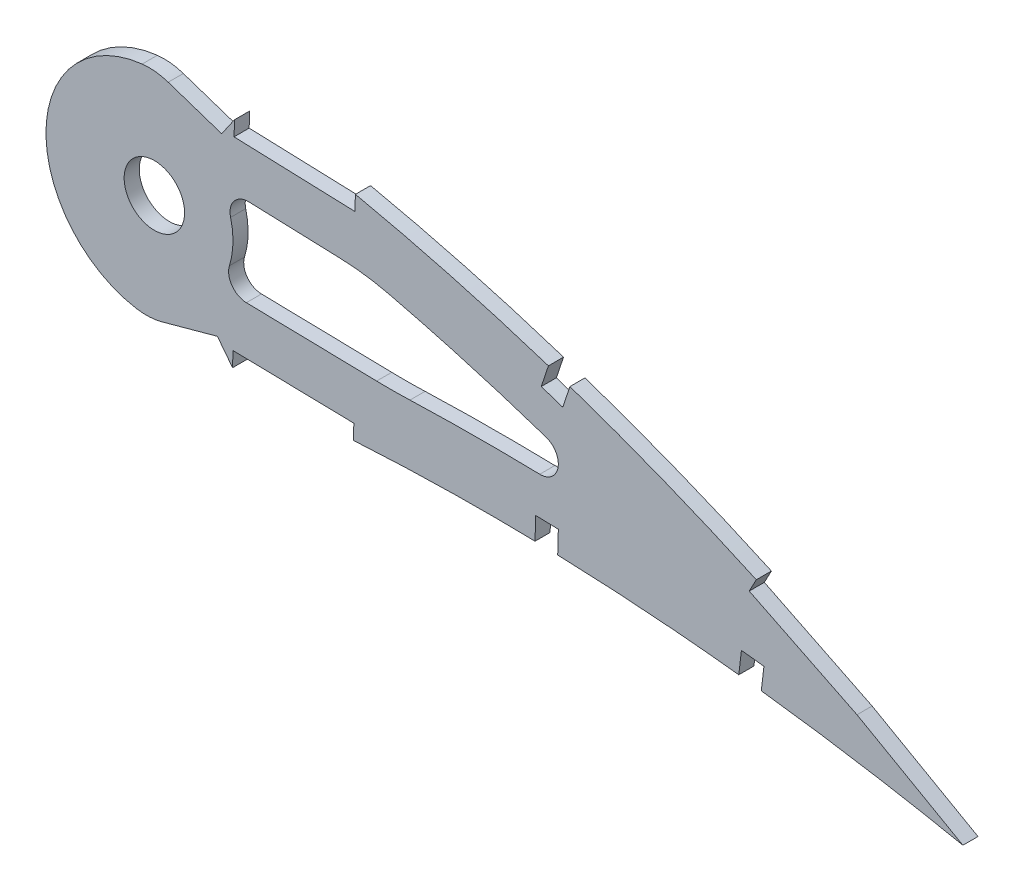
from build123d import *

# Parameters (mm, degrees)
BOSS_EXTRUDE1_DEPTH = 3.175
SKETCH2_R           = 6.35
CUT_EXTRUDE2_DEPTH  = 564.352625878
CUT_EXTRUDE3_DEPTH  = 563.080828658
FILLET1_R           = 50.8
FILLET1_R_2         = 127
FILLET1_R_3         = 12.7
FILLET2_R           = 3.81


with BuildPart() as part:
    # Sketch1 → Boss-Extrude1 (new body)
    with BuildSketch(Plane.XY):
        with BuildLine():
            Line((554.319679776, 0.86419944), (558.957809165, -2.001035064))
            Line((558.957809165, -2.001035064), (553.628320224, -0.86419944))
            add(Edge.make_bspline(
                [(0, 0), (0.142347333, -0.671974339), (0.427696201, -2.019011291), (1.202951825, -3.958186399), (2.228190383, -5.822295383), (3.524929277, -7.606386734), (5.084546434, -9.309972854), (6.903597265, -10.934825666), (8.980297835, -12.480071531), (11.311930113, -13.945007192), (13.895107055, -15.331187734), (16.726925172, -16.637751335), (19.804802415, -17.864289685), (23.125385358, -19.009163213), (26.684614497, -20.074115536), (30.479105895, -21.056551439), (34.504544841, -21.957844058), (38.757059621, -22.775692741), (43.232016315, -23.51092839), (47.924766072, -24.163139529), (52.830492114, -24.732734078), (57.944381557, -25.218516849), (63.261376247, -25.621532707), (68.776176668, -25.942049027), (74.483429701, -26.181082136), (80.377668399, -26.337723359), (86.453120028, -26.414414727), (92.704294081, -26.412307583), (99.12507542, -26.330838336), (105.709979181, -26.174507632), (112.452686417, -25.942325241), (119.34710982, -25.637100851), (126.387030529, -25.261906112), (133.566134503, -24.818012975), (140.878103886, -24.307388732), (148.316589874, -23.734128332), (155.874835295, -23.099661672), (163.546248351, -22.407686904), (171.324037493, -21.661668186), (179.201482843, -20.863966544), (187.171631155, -20.018334408), (195.227383554, -19.127512044), (203.361887075, -18.196251983), (211.567710876, -17.226239107), (219.837916048, -16.22301178), (228.164722411, -15.188486752), (236.541167073, -14.126648704), (244.959716224, -13.042497308), (253.412488668, -11.935908902), (261.892375024, -10.814767477), (270.391197565, -9.678149682), (278.901558654, -8.531901132), (287.415580323, -7.379584718), (295.924969849, -6.221555103), (304.422247183, -5.062611436), (312.899529628, -3.905935256), (321.348513524, -2.751632242), (329.761554776, -1.605439772), (338.130181703, -0.467217682), (346.446677596, 0.66072628), (354.703072912, 1.775025333), (362.891578136, 2.874273125), (371.003746299, 3.95777416), (379.031415912, 5.025935363), (386.846329345, 6.046335331), (394.428066205, 7.073310729), (401.802175451, 7.915202937), (409.084467689, 8.633788237), (416.282507375, 9.222929029), (423.387651297, 9.691101248), (430.391758492, 10.041650224), (437.286481508, 10.279470026), (444.063111322, 10.411615906), (450.713183761, 10.441441391), (457.227621753, 10.378458054), (463.597952606, 10.227742854), (469.815285453, 9.996060674), (475.870946567, 9.691228076), (481.756334452, 9.321555013), (487.462613384, 8.892494437), (492.981831848, 8.414063018), (498.305474549, 7.893264408), (503.42536692, 7.336048865), (508.334038343, 6.754092224), (513.023631908, 6.151226115), (517.487093749, 5.537357776), (521.717238913, 4.918708145), (525.707368004, 4.303175514), (529.451211936, 3.69663199), (532.942723228, 3.107128036), (536.176432542, 2.540171416), (539.146728498, 2.001298937), (541.849490456, 1.497309641), (544.279380439, 1.030707122), (546.433148645, 0.609181062), (548.306790372, 0.234591467), (549.897558991, -0.087784135), (551.202676422, -0.356673457), (552.220160436, -0.56766247), (552.948001318, -0.721088328), (553.38541182, -0.812384542), (553.579758931, -0.853840809), (553.628320224, -0.86419944)],
                knots=[0, 0, 0, 0, 0.003638255, 0.007293231, 0.011028136, 0.014901081, 0.018963272, 0.023258475, 0.027820626, 0.032679082, 0.03785316, 0.043361875, 0.049214679, 0.055422346, 0.061988786, 0.068918036, 0.076211157, 0.083868392, 0.091887411, 0.100265912, 0.108999867, 0.118084529, 0.127514843, 0.13728527, 0.147387917, 0.157816481, 0.168563473, 0.179619128, 0.190977373, 0.202626974, 0.214560478, 0.226767249, 0.239236417, 0.251959004, 0.264923894, 0.278119703, 0.291536035, 0.30516028, 0.318980685, 0.332985499, 0.34716279, 0.361498603, 0.375980747, 0.390597192, 0.405332593, 0.420174823, 0.435109533, 0.450124276, 0.465203068, 0.480333154, 0.495500583, 0.510689775, 0.525887334, 0.541078314, 0.556247233, 0.571381784, 0.58646604, 0.601484516, 0.616424329, 0.631269422, 0.646006524, 0.660620684, 0.675098187, 0.689422858, 0.703581825, 0.716907563, 0.730009274, 0.742952128, 0.755725558, 0.768319952, 0.780724337, 0.792926529, 0.804916041, 0.816679084, 0.828203524, 0.8394749, 0.850481359, 0.861207697, 0.871639326, 0.881763414, 0.891563605, 0.901027364, 0.910138977, 0.918883976, 0.927249278, 0.935221104, 0.942784739, 0.949928188, 0.956638464, 0.962904203, 0.968712288, 0.974054485, 0.978918432, 0.983297218, 0.987180246, 0.990560674, 0.993433357, 0.995790626, 0.997629587, 0.998945816, 0.999736592, 1, 1, 1, 1], degree=3))
            add(Edge.make_bspline(
                [(554.319679776, 0.86419944), (554.277215357, 0.89043211), (554.107522459, 0.995260998), (553.725173452, 1.229788681), (553.088482836, 1.620406322), (552.19717161, 2.164400829), (551.051931791, 2.860327436), (549.65218736, 3.7033132), (547.998812126, 4.690619378), (546.092206237, 5.81757636), (543.932565, 7.078907467), (541.52071076, 8.469502775), (538.856853433, 9.981489509), (535.942024994, 11.608689713), (532.777225355, 13.343364367), (529.363053286, 15.177678879), (525.700731311, 17.102302694), (521.79166531, 19.108957931), (517.636567952, 21.18656326), (513.237398289, 23.326472309), (508.595621965, 25.518015349), (503.712823317, 27.749500198), (498.591807417, 30.011830061), (493.233990123, 32.290940283), (487.642424763, 34.57695634), (481.8194918, 36.856868062), (475.768638934, 39.12029206), (469.492200651, 41.35256543), (462.994868721, 43.543932934), (456.279795024, 45.680158729), (449.351781723, 47.749641178), (442.214854104, 49.738962731), (434.874961581, 51.637921), (427.336759134, 53.432686996), (419.606635925, 55.111247293), (411.690736529, 56.663495899), (403.59569977, 58.073935714), (395.343957759, 59.341467114), (387.068279135, 60.395838633), (378.809627081, 61.42993544), (370.563274167, 62.401374837), (362.216133558, 63.331662392), (353.776235693, 64.21556045), (345.251952273, 65.05030505), (336.651912889, 65.832293537), (327.985054567, 66.559232675), (319.259763743, 67.227003304), (310.485240764, 67.834576684), (301.670160415, 68.37661144), (292.823911811, 68.852700647), (283.955475072, 69.25952388), (275.074079257, 69.594278035), (266.18915515, 69.854942273), (257.309925599, 70.039019354), (248.446004557, 70.145351939), (239.606611877, 70.171034575), (230.801357025, 70.115607817), (222.039460543, 69.97716855), (213.3305417, 69.753821594), (204.683833617, 69.445150093), (196.108686361, 69.051287938), (187.614488849, 68.568936811), (179.210455771, 68.001170586), (170.905945703, 67.345604232), (162.710082946, 66.602063396), (154.631456842, 65.773647434), (146.679061666, 64.85810318), (138.86141998, 63.858035618), (131.187082706, 62.775405546), (123.664660665, 61.60962319), (116.302212041, 60.364055914), (109.107683022, 59.039978082), (102.088685401, 57.641271481), (95.252861003, 56.16830103), (88.607445909, 54.6254852), (82.159346438, 53.015511993), (75.915494147, 51.341328746), (69.8822185, 49.606952764), (64.065620452, 47.816318831), (58.472480769, 45.971394518), (53.107026632, 44.079174913), (47.975848961, 42.141003285), (43.082878389, 40.162850581), (38.433849103, 38.1474178), (34.032234114, 36.100849009), (29.88301504, 34.025474172), (25.989149052, 31.927107779), (22.354545271, 29.808967438), (18.982702419, 27.674987384), (15.875037644, 25.530580581), (13.035835571, 23.377093004), (10.466071509, 21.219966433), (8.16737168, 19.062485607), (6.143021854, 16.906136722), (4.392949166, 14.754717117), (2.919447156, 12.609930647), (1.722771461, 10.473806788), (0.805628768, 8.347897258), (0.167109617, 6.233397613), (-0.182411483, 4.133428796), (-0.269409401, 2.046307302), (-0.089668952, 0.681083253), (0, 0)],
                knots=[0, 0, 0, 0, 0.00025409, 0.001015373, 0.002283359, 0.004056577, 0.006330982, 0.009105274, 0.012374489, 0.016134023, 0.02037966, 0.025105976, 0.030306237, 0.035972206, 0.042099522, 0.048678064, 0.055701664, 0.063160184, 0.071045824, 0.079349827, 0.08806291, 0.097175756, 0.106678112, 0.116561573, 0.126814276, 0.137428301, 0.148393618, 0.15969976, 0.171338126, 0.183297699, 0.195569604, 0.208143555, 0.221011593, 0.234161831, 0.24758745, 0.261276822, 0.27522271, 0.289414144, 0.3037712, 0.317689227, 0.331784111, 0.346039677, 0.360443869, 0.37498272, 0.389640454, 0.404403317, 0.419256601, 0.434186749, 0.449177265, 0.464214782, 0.479284009, 0.49436974, 0.509457833, 0.524532346, 0.53957932, 0.554582984, 0.569529546, 0.584403417, 0.599190992, 0.613876838, 0.628447475, 0.642888675, 0.657186054, 0.671325546, 0.685294014, 0.699078147, 0.712665095, 0.726042645, 0.739197713, 0.752117586, 0.764792042, 0.777208152, 0.789355685, 0.80122396, 0.812803686, 0.824082909, 0.835054602, 0.845709571, 0.856037853, 0.866033834, 0.875688843, 0.884997719, 0.893953426, 0.902552897, 0.910789386, 0.918660734, 0.926166253, 0.933302626, 0.94007122, 0.94647478, 0.952517526, 0.958204819, 0.963546652, 0.9685566, 0.973249913, 0.977651041, 0.981787043, 0.985694226, 0.989415109, 0.993001157, 0.996508416, 1, 1, 1, 1], degree=3))
        make_face()
    extrude(amount=BOSS_EXTRUDE1_DEPTH)

    # Sketch2 → Cut-Extrude2 (cut, through all)
    with BuildSketch(Plane.XY.offset(3.175)):
        with BuildLine():
            add(Edge.make_bspline(
                [(430.319647944, 22.731694653), (431.264230074, 22.770688174), (435.808989207, 22.944352135), (447.913572783, 23.229268702), (465.339210521, 23.013958543), (479.127970057, 22.247870873), (485.365038234, 21.782948535)],
                knots=[0.781455055, 0.781455055, 0.781455055, 0.781455055, 0.786332099, 0.804918237, 0.84393459, 0.876262436, 0.876262436, 0.876262436, 0.876262436], degree=3))
            add(Edge.make_bspline(
                [(485.365038234, 21.782948535), (479.761968163, 24.067699535), (467.25658071, 28.842360136), (447.690245821, 35.194739683), (432.770350963, 39.127735095), (424.880445033, 40.94125454), (423.987569299, 41.143106247)],
                knots=[0.122316233, 0.122316233, 0.122316233, 0.122316233, 0.15408987, 0.192612338, 0.230383121, 0.235198429, 0.235198429, 0.235198429, 0.235198429], degree=3))
            Line((423.987569299, 41.143106247), (393.784366968, 42.194221297))
            ThreePointArc((393.784366968, 42.194221297), (395.753496119, 37.904332136), (396.428257434, 33.232574886))
            ThreePointArc((396.428257434, 33.232574886), (395.61695356, 28.120721999), (393.262777127, 23.511263546))
            Line((393.262777127, 23.511263546), (430.319647944, 22.731694653))
        make_face()
        with BuildLine():
            Line((396.762798542, 55.433640414), (396.889843899, 59.084217589))
            add(Edge.make_bspline(
                [(396.889843899, 59.084217589), (396.383806872, 59.157719538), (393.085664831, 59.629187295), (388.86659439, 60.166722391), (385.154250522, 60.634214657), (384.240082989, 60.748731992)],
                knots=[0.286811105, 0.286811105, 0.286811105, 0.286811105, 0.289414144, 0.3037712, 0.3084612, 0.3084612, 0.3084612, 0.3084612], degree=3))
            add(Edge.make_bspline(
                [(384.240082989, 60.748731992), (383.657484653, 60.821713811), (383.074858449, 60.894454232), (382.492195116, 60.966884375)],
                knots=[0.3084612, 0.3084612, 0.3084612, 0.3084612, 0.311450134, 0.311450134, 0.311450134, 0.311450134], degree=3))
            ThreePointArc((382.492195116, 60.966884375), (369.217960933, 58.948731924), (358.430176965, 50.95486243))
            add(Edge.make_bspline(
                [(364.799446961, 50.263533696), (363.364931465, 50.422919238), (361.241622812, 50.655054407), (359.11839834, 50.881893785), (358.430176965, 50.95486243)],
                knots=[0.339284908, 0.339284908, 0.339284908, 0.339284908, 0.346702208, 0.350259533, 0.350259533, 0.350259533, 0.350259533], degree=3))
            ThreePointArc((364.799446961, 50.263533696), (372.203432265, 54.659507954), (380.710328366, 55.992289553))
            Line((380.710328366, 55.992289553), (396.762798542, 55.433640414))
        make_face()
        with BuildLine():
            ThreePointArc((365.057349478, 15.976115144), (357.145408535, 33.061282461), (364.799446961, 50.263533696))
            add(Edge.make_bspline(
                [(364.799446961, 50.263533696), (363.364931465, 50.422919238), (361.241622812, 50.655054407), (359.11839834, 50.881893785), (358.430176965, 50.95486243)],
                knots=[0.339284908, 0.339284908, 0.339284908, 0.339284908, 0.346702208, 0.350259533, 0.350259533, 0.350259533, 0.350259533], degree=3))
            ThreePointArc((358.430176965, 50.95486243), (352.065861583, 32.985343449), (358.748161408, 15.131632582))
            add(Edge.make_bspline(
                [(358.748161408, 15.131632582), (360.851423884, 15.413689954), (362.954628563, 15.695174464), (365.057349478, 15.976115144)],
                knots=[0.65619395, 0.65619395, 0.65619395, 0.65619395, 0.667439043, 0.667439043, 0.667439043, 0.667439043], degree=3))
        make_face()
        with BuildLine():
            ThreePointArc((379.439275285, 10.464119422), (371.768191096, 11.96738251), (365.057349478, 15.976115144))
            add(Edge.make_bspline(
                [(358.748161408, 15.131632582), (360.851423884, 15.413689954), (362.954628563, 15.695174464), (365.057349478, 15.976115144)],
                knots=[0.65619395, 0.65619395, 0.65619395, 0.65619395, 0.667439043, 0.667439043, 0.667439043, 0.667439043], degree=3))
            ThreePointArc((358.748161408, 15.131632582), (369.94298629, 7.226593966), (383.552675487, 5.61721533))
            add(Edge.make_bspline(
                [(383.552675487, 5.61721533), (384.702288335, 5.768514236), (388.342225507, 6.248960215), (392.585302947, 6.823701363), (395.684467852, 7.202111347), (396.290352256, 7.274612839)],
                knots=[0.697430662, 0.697430662, 0.697430662, 0.697430662, 0.703581825, 0.716907563, 0.720144627, 0.720144627, 0.720144627, 0.720144627], degree=3))
            Line((396.290352256, 7.274612839), (396.349966223, 10.108367619))
            Line((396.349966223, 10.108367619), (379.439275285, 10.464119422))
        make_face()
        with BuildLine():
            ThreePointArc((358.430176965, 50.95486243), (369.217960933, 58.948731924), (382.492195116, 60.966884375))
            add(Edge.make_bspline(
                [(382.492195116, 60.966884375), (381.275945111, 61.118074877), (377.311508316, 61.606417287), (370.563274167, 62.401374837), (362.216133558, 63.331662392), (353.776235693, 64.21556045), (345.251952273, 65.05030505), (336.651912889, 65.832293537), (327.985054567, 66.559232675), (319.259763743, 67.227003304), (310.485240764, 67.834576684), (301.670160415, 68.37661144), (292.823911811, 68.852700647), (283.955475072, 69.25952388), (275.074079257, 69.594278035), (266.18915515, 69.854942273), (257.309925599, 70.039019354), (248.446004557, 70.145351939), (239.606611877, 70.171034575), (230.801357025, 70.115607817), (222.039460543, 69.97716855), (213.3305417, 69.753821594), (207.056942761, 69.529865705), (203.687254317, 69.389343527), (203.200000001, 69.368596042)],
                knots=[0.311450134, 0.311450134, 0.311450134, 0.311450134, 0.317689227, 0.331784111, 0.346039677, 0.360443869, 0.37498272, 0.389640454, 0.404403317, 0.419256601, 0.434186749, 0.449177265, 0.464214782, 0.479284009, 0.49436974, 0.509457833, 0.524532346, 0.53957932, 0.554582984, 0.569529546, 0.584403417, 0.599190992, 0.613876838, 0.616359481, 0.616359481, 0.616359481, 0.616359481], degree=3))
            add(Edge.make_bspline(
                [(203.200000001, 69.368596042), (200.827557407, 69.267576479), (195.621767882, 69.023637807), (187.614488849, 68.568936811), (179.210455771, 68.001170586), (170.905945703, 67.345604232), (162.710082946, 66.602063396), (154.631456842, 65.773647434), (146.679061666, 64.85810318), (138.86141998, 63.858035618), (131.187082706, 62.775405546), (123.664660665, 61.60962319), (116.302212041, 60.364055914), (109.107683022, 59.039978082), (102.088685401, 57.641271481), (95.252861003, 56.16830103), (88.607445909, 54.6254852), (82.159346438, 53.015511993), (75.915494147, 51.341328746), (69.8822185, 49.606952764), (64.065620452, 47.816318831), (58.472480769, 45.971394518), (53.107026632, 44.079174913), (47.975848961, 42.141003285), (43.082878389, 40.162850581), (38.433849103, 38.1474178), (34.032234114, 36.100849009), (29.88301504, 34.025474172), (25.989149052, 31.927107779), (22.354545271, 29.808967438), (18.982702419, 27.674987384), (15.875037644, 25.530580581), (13.035835571, 23.377093004), (10.466071509, 21.219966433), (8.16737168, 19.062485607), (6.143021854, 16.906136722), (4.392949166, 14.754717117), (2.919447156, 12.609930647), (1.722771461, 10.473806788), (0.805628768, 8.347897258), (0.167109617, 6.233397613), (-0.182411483, 4.133428796), (-0.269409401, 2.046307302), (-0.089668952, 0.681083253), (0, 0)],
                knots=[0.616359481, 0.616359481, 0.616359481, 0.616359481, 0.628447475, 0.642888675, 0.657186054, 0.671325546, 0.685294014, 0.699078147, 0.712665095, 0.726042645, 0.739197713, 0.752117586, 0.764792042, 0.777208152, 0.789355685, 0.80122396, 0.812803686, 0.824082909, 0.835054602, 0.845709571, 0.856037853, 0.866033834, 0.875688843, 0.884997719, 0.893953426, 0.902552897, 0.910789386, 0.918660734, 0.926166253, 0.933302626, 0.94007122, 0.94647478, 0.952517526, 0.958204819, 0.963546652, 0.9685566, 0.973249913, 0.977651041, 0.981787043, 0.985694226, 0.989415109, 0.993001157, 0.996508416, 1, 1, 1, 1], degree=3))
            add(Edge.make_bspline(
                [(0, 0), (0.142347333, -0.671974339), (0.427696201, -2.019011291), (1.202951825, -3.958186399), (2.228190383, -5.822295383), (3.524929277, -7.606386734), (5.084546434, -9.309972854), (6.903597265, -10.934825666), (8.980297835, -12.480071531), (11.311930113, -13.945007192), (13.895107055, -15.331187734), (16.726925172, -16.637751335), (19.804802415, -17.864289685), (23.125385358, -19.009163213), (26.684614497, -20.074115536), (30.479105895, -21.056551439), (34.504544841, -21.957844058), (38.757059621, -22.775692741), (43.232016315, -23.51092839), (47.924766072, -24.163139529), (52.830492114, -24.732734078), (57.944381557, -25.218516849), (63.261376247, -25.621532707), (68.776176668, -25.942049027), (74.483429701, -26.181082136), (80.377668399, -26.337723359), (86.453120028, -26.414414727), (92.704294081, -26.412307583), (99.12507542, -26.330838336), (105.709979181, -26.174507632), (112.452686417, -25.942325241), (119.34710982, -25.637100851), (126.387030529, -25.261906112), (133.566134503, -24.818012975), (140.878103886, -24.307388732), (148.316589874, -23.734128332), (155.874835295, -23.099661672), (163.546248351, -22.407686904), (171.324037493, -21.661668186), (179.201482843, -20.863966544), (187.171631155, -20.018334408), (195.181968772, -19.132534108), (200.533692255, -18.520029919), (203.2, -18.210003984)],
                knots=[0, 0, 0, 0, 0.003638255, 0.007293231, 0.011028136, 0.014901081, 0.018963272, 0.023258475, 0.027820626, 0.032679082, 0.03785316, 0.043361875, 0.049214679, 0.055422346, 0.061988786, 0.068918036, 0.076211157, 0.083868392, 0.091887411, 0.100265912, 0.108999867, 0.118084529, 0.127514843, 0.13728527, 0.147387917, 0.157816481, 0.168563473, 0.179619128, 0.190977373, 0.202626974, 0.214560478, 0.226767249, 0.239236417, 0.251959004, 0.264923894, 0.278119703, 0.291536035, 0.30516028, 0.318980685, 0.332985499, 0.34716279, 0.361498603, 0.375738358, 0.375738358, 0.375738358, 0.375738358], degree=3))
            add(Edge.make_bspline(
                [(203.2, -18.210003984), (203.245385729, -18.204726741), (206.027602093, -17.881137017), (211.567710876, -17.226239107), (219.837916048, -16.22301178), (228.164722411, -15.188486752), (236.541167073, -14.126648704), (244.959716224, -13.042497308), (253.412488668, -11.935908902), (261.892375024, -10.814767477), (270.391197565, -9.678149682), (278.901558654, -8.531901132), (287.415580323, -7.379584718), (295.924969849, -6.221555103), (304.422247183, -5.062611436), (312.899529628, -3.905935256), (321.348513524, -2.751632242), (329.761554776, -1.605439772), (338.130181703, -0.467217682), (346.446677596, 0.66072628), (354.703072912, 1.775025333), (362.891578136, 2.874273125), (371.003746299, 3.95777416), (377.882016726, 4.872996381), (382.056068187, 5.420248979), (383.552675487, 5.61721533)],
                knots=[0.375738358, 0.375738358, 0.375738358, 0.375738358, 0.375980747, 0.390597192, 0.405332593, 0.420174823, 0.435109533, 0.450124276, 0.465203068, 0.480333154, 0.495500583, 0.510689775, 0.525887334, 0.541078314, 0.556247233, 0.571381784, 0.58646604, 0.601484516, 0.616424329, 0.631269422, 0.646006524, 0.660620684, 0.675098187, 0.689422858, 0.697430662, 0.697430662, 0.697430662, 0.697430662], degree=3))
            ThreePointArc((383.552675487, 5.61721533), (369.94298629, 7.226593966), (358.748161408, 15.131632582))
            ThreePointArc((358.748161408, 15.131632582), (352.065861583, 32.985343449), (358.430176965, 50.95486243))
        make_face()
        with Locations((379.918257434, 33.232574886)):
            Circle(SKETCH2_R)
    extrude(amount=-CUT_EXTRUDE2_DEPTH, mode=Mode.SUBTRACT)

    # Sketch2<6> → Cut-Extrude3 (cut, through all)
    with BuildSketch(Plane.XY.offset(3.175)):
        with BuildLine():
            add(Edge.make_bspline(
                [(396.290352256, 7.274612839), (398.136727706, 7.495554283), (402.409451722, 7.975126349), (409.084467689, 8.633788237), (415.72330915, 9.177160111), (419.934699533, 9.46253252), (421.744347585, 9.574143619)],
                knots=[0.720144627, 0.720144627, 0.720144627, 0.720144627, 0.730009274, 0.742952128, 0.755725558, 0.765343688, 0.765343688, 0.765343688, 0.765343688], degree=3))
            Line((421.744347585, 9.574143619), (421.811125585, 12.748441289))
            Line((421.811125585, 12.748441289), (396.416744223, 13.282665289))
            Line((396.416744223, 13.282665289), (396.349966223, 10.108367619))
            Line((396.349966223, 10.108367619), (396.290352256, 7.274612839))
        make_face()
        with BuildLine():
            Line((422.037003283, 51.377139493), (422.147431016, 54.550218552))
            add(Edge.make_bspline(
                [(422.147431016, 54.550218552), (421.316162856, 54.727639621), (417.852539183, 55.455212531), (411.690736529, 56.663495899), (404.099485586, 57.986158525), (399.142655863, 58.756996338), (396.889843899, 59.084217589)],
                knots=[0.243260576, 0.243260576, 0.243260576, 0.243260576, 0.24758745, 0.261276822, 0.27522271, 0.286811105, 0.286811105, 0.286811105, 0.286811105], degree=3))
            Line((396.889843899, 59.084217589), (396.762798542, 55.433640414))
            Line((396.762798542, 55.433640414), (396.652370809, 52.260561355))
            Line((396.652370809, 52.260561355), (422.037003283, 51.377139493))
        make_face()
        with BuildLine():
            Line((465.70323515, 37.598211465), (467.209149493, 42.116355802))
            add(Edge.make_bspline(
                [(467.209149493, 42.116355802), (465.824807335, 42.586800247), (464.318976711, 43.089524265), (462.810216836, 43.583315899), (462.691005156, 43.622270144)],
                knots=[0.163895303, 0.163895303, 0.163895303, 0.163895303, 0.171338126, 0.171976552, 0.171976552, 0.171976552, 0.171976552], degree=3))
            Line((462.691005156, 43.622270144), (461.185090814, 39.104125807))
            Line((461.185090814, 39.104125807), (465.70323515, 37.598211465))
        make_face()
        with BuildLine():
            add(Edge.make_bspline(
                [(459.879103244, 10.311689689), (461.135341228, 10.283565404), (462.722305811, 10.241557507), (464.30902069, 10.191396505), (464.639798364, 10.180585804)],
                knots=[0.83280908, 0.83280908, 0.83280908, 0.83280908, 0.8394749, 0.841230563, 0.841230563, 0.841230563, 0.841230563], degree=3))
            Line((464.639798364, 10.180585804), (464.770902249, 14.941280924))
            Line((464.770902249, 14.941280924), (460.010207129, 15.072384808))
            Line((460.010207129, 15.072384808), (459.879103244, 10.311689689))
        make_face()
        with BuildLine():
            add(Edge.make_bspline(
                [(502.678008103, 7.412318954), (502.949735923, 7.38183069), (504.527203321, 7.203572908), (506.10385769, 7.018174275), (507.408319717, 6.859545689)],
                knots=[0.908688453, 0.908688453, 0.908688453, 0.908688453, 0.910138977, 0.917109959, 0.917109959, 0.917109959, 0.917109959], degree=3))
            Line((507.408319717, 6.859545689), (507.961092982, 11.589857303))
            Line((507.961092982, 11.589857303), (503.230781368, 12.142630569))
            Line((503.230781368, 12.142630569), (502.678008103, 7.412318954))
        make_face()
        with BuildLine():
            Line((506.354258736, 26.539215432), (504.86721765, 23.733982142))
            Line((504.86721765, 23.733982142), (515.111548813, 18.678483508))
            add(Edge.make_bspline(
                [(515.111548813, 18.678483508), (518.593652962, 18.212598534), (522.069760329, 17.712008655), (525.540913255, 17.177571078)],
                knots=[0.927841307, 0.927841307, 0.927841307, 0.927841307, 0.946035686, 0.946035686, 0.946035686, 0.946035686], degree=3))
            add(Edge.make_bspline(
                [(525.540913255, 17.177571078), (524.317885644, 17.812133814), (521.713564224, 19.148009539), (517.636567952, 21.18656326), (513.237398289, 23.326472309), (509.448353394, 25.115411368), (507.124646759, 26.186791661), (506.354258736, 26.539215432)],
                knots=[0.056146166, 0.056146166, 0.056146166, 0.056146166, 0.063160184, 0.071045824, 0.079349827, 0.08806291, 0.092375479, 0.092375479, 0.092375479, 0.092375479], degree=3))
        make_face()
        with BuildLine():
            add(Edge.make_bspline(
                [(515.111548813, 18.678483508), (518.593652962, 18.212598534), (522.069760329, 17.712008655), (525.540913255, 17.177571078)],
                knots=[0.927841307, 0.927841307, 0.927841307, 0.927841307, 0.946035686, 0.946035686, 0.946035686, 0.946035686], degree=3))
            Line((515.111548813, 18.678483508), (527.505109575, 12.562356596))
            Line((527.505109575, 12.562356596), (528.99215066, 15.367589886))
            add(Edge.make_bspline(
                [(528.99215066, 15.367589886), (527.92156351, 15.935103142), (526.771304667, 16.53875549), (525.618420561, 17.137356738), (525.540913255, 17.177571078)],
                knots=[0.049533404, 0.049533404, 0.049533404, 0.049533404, 0.055701664, 0.056146166, 0.056146166, 0.056146166, 0.056146166], degree=3))
        make_face()
        with BuildLine():
            Line((528.99215066, 15.367589886), (527.505109575, 12.562356596))
            Line((527.505109575, 12.562356596), (549.750950289, -0.058675221))
            Line((549.750950289, -0.058675221), (551.237991374, 2.746558069))
            add(Edge.make_bspline(
                [(551.237991374, 2.746558069), (551.203809894, 2.767260117), (550.703426484, 3.070212188), (549.65218736, 3.7033132), (547.998812126, 4.690619378), (546.092206237, 5.81757636), (543.932565, 7.078907467), (541.52071076, 8.469502775), (538.856853433, 9.981489509), (535.942024994, 11.608689713), (532.777225355, 13.343364367), (530.430467261, 14.604194911), (529.140606939, 15.288893905), (528.99215066, 15.367589886)],
                knots=[0.006127553, 0.006127553, 0.006127553, 0.006127553, 0.006330982, 0.009105274, 0.012374489, 0.016134023, 0.02037966, 0.025105976, 0.030306237, 0.035972206, 0.042099522, 0.048678064, 0.049533404, 0.049533404, 0.049533404, 0.049533404], degree=3))
        make_face()
        with BuildLine():
            Line((551.237991374, 2.746558069), (549.750950289, -0.058675221))
            add(Edge.make_bspline(
                [(549.750950289, -0.058675221), (549.83150078, -0.075104089), (550.34741821, -0.180467244), (551.202676422, -0.356673457), (552.220160436, -0.56766247), (552.948001318, -0.721088328), (553.38541182, -0.812384542), (553.579758931, -0.853840809), (553.628320224, -0.86419944)],
                knots=[0.992997249, 0.992997249, 0.992997249, 0.992997249, 0.993433357, 0.995790626, 0.997629587, 0.998945816, 0.999736592, 1, 1, 1, 1], degree=3))
            Line((553.628320224, -0.86419944), (558.957809165, -2.001035064))
            Line((558.957809165, -2.001035064), (554.319679776, 0.86419944))
            add(Edge.make_bspline(
                [(554.319679776, 0.86419944), (554.277215357, 0.89043211), (554.107522459, 0.995260998), (553.725173452, 1.229788681), (553.088482836, 1.620406322), (552.23128219, 2.143582098), (551.585970459, 2.535804189), (551.237991374, 2.746558069)],
                knots=[0, 0, 0, 0, 0.00025409, 0.001015373, 0.002283359, 0.004056577, 0.006127553, 0.006127553, 0.006127553, 0.006127553], degree=3))
        make_face()
        Polygon((394.045241278, 51.522593397), (380.710328366, 55.992289553), (396.762798542, 55.433640414), align=None)
        Polygon((396.349966223, 10.108367619), (393.158929667, 14.222992109), (379.439275285, 10.464119422), align=None)
    extrude(amount=-CUT_EXTRUDE3_DEPTH, mode=Mode.SUBTRACT)

    # Fillet1
    # the kernel refuses this fillet: 127, 50.8, 12.7 mm, written as the material it adds along each edge
    with BuildSketch(Plane(origin=(423.987569299, 41.143106247, 3.175), x_dir=(0.9738265954886574, -0.22729223902054105, 0), z_dir=(0, 0, -1))) as fillet1_piece_1:
        with BuildLine():
            CenterArc((4.962407975, 50.79876917), FILLET1_R, 258.855464671, 11.543381787)
            Line((-4.85645252, 0.956718865), (0, 0))
            ThreePointArc((0, 0), (2.658016638, -0.009255614), (5.316033262, 0))
        make_face()
    extrude(amount=3.175)
    with BuildSketch(Plane(origin=(430.319647944, 22.731694653, 3.175), x_dir=(0.9992892103936086, 0.03769713504920768, 0), z_dir=(0, 0, -1))) as fillet1_piece_2:
        with BuildLine():
            CenterArc((3.744631352, -126.999202297), FILLET1_R_2, 90.203075128, 3.162482461)
            Line((-3.711067163, -0.218239374), (0, 0))
            ThreePointArc((0, 0), (1.647251222, -0.002922099), (3.294502432, 0))
        make_face()
    extrude(amount=3.175)
    # the kernel refuses this fillet: 127, 50.8, 12.7 mm, written as the material it takes off along each edge
    with BuildSketch(Plane(origin=(380.710328366, 55.992289553, 11.55293141), x_dir=(0.9481545668901665, -0.31780956134975047, 0), z_dir=(0, 0, -1))) as fillet1_2_piece_1:
        with BuildLine():
            CenterArc((2.228804693, 12.7), FILLET1_R_3, 245.023830384, 24.976169616)
            ThreePointArc((-3.133659498, 1.18765976), (-1.588705257, 0.536110997), (0, 0))
            Line((0, 0), (2.228804693, 0))
        make_face()
    extrude(amount=19.930862819, mode=Mode.SUBTRACT)
    with BuildSketch(Plane(origin=(379.439275285, 10.464119422, 11.547519733), x_dir=(-0.9955260117844565, 0.09448788208301703, 0), z_dir=(0, 0, -1))) as fillet1_2_piece_2:
        with BuildLine():
            CenterArc((2.415194181, 12.665622446), FILLET1_R_3, 249.256399128, 24.960286938)
            Line((-2.082975568, 0.788902827), (0, 0))
            ThreePointArc((0, 0), (1.674503947, -0.061645432), (3.349007893, 0))
        make_face()
    extrude(amount=19.920039465, mode=Mode.SUBTRACT)

    # Fillet2
    fillet2_edges = [part.edges().sort_by_distance(p)[0] for p in [
        (485.365038234, 21.782948535, 1.5875),
        (393.784366968, 42.194221297, 1.5875),
        (393.262777127, 23.511263546, 1.5875),
    ]]
    fillet(fillet2_edges, radius=FILLET2_R)


solid = part.part
